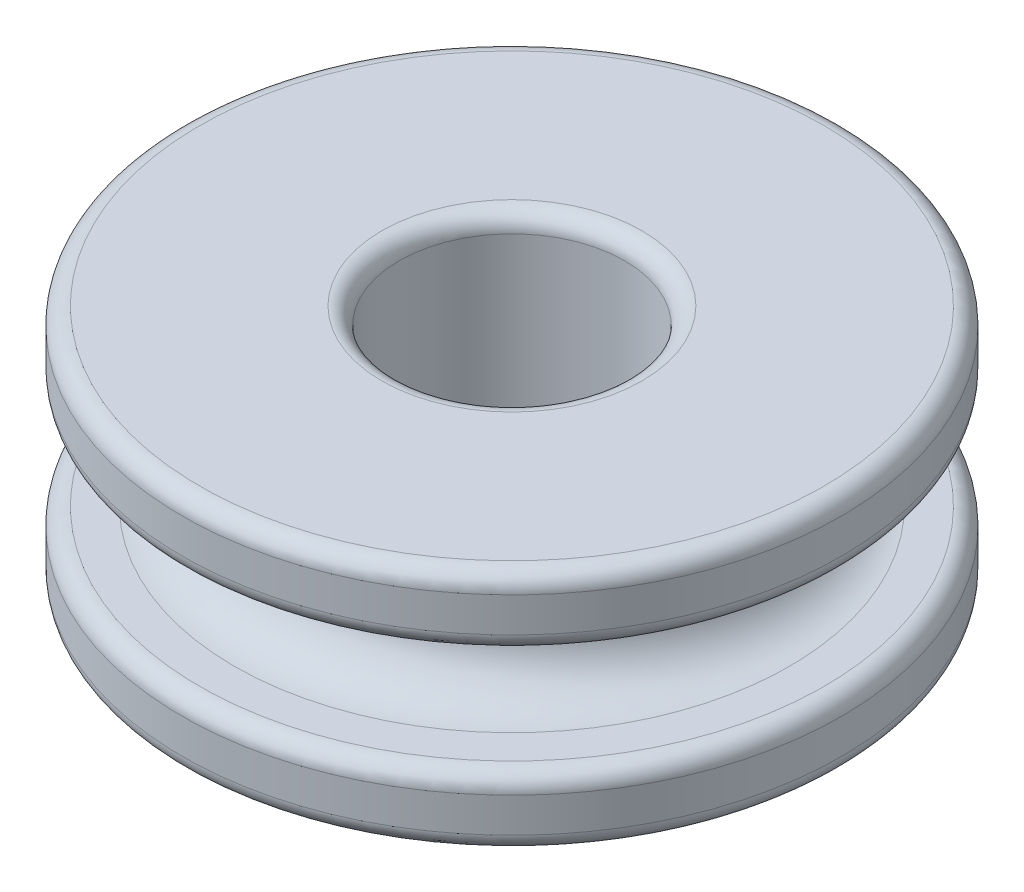
from build123d import *

# Parameters (mm, degrees)
FILLET1_R = 0.5


with BuildPart() as part:
    # Sketch1 → Revolve1 (revolve)
    with BuildSketch(Plane.XY):
        with BuildLine():
            Line((1.625, 3.5), (1.625, -3.5))
            Line((1.625, -3.5), (6.375, -3.5))
            Line((6.375, -3.5), (7.875, -3.5))
            Line((7.875, -3.5), (7.875, -1.5))
            Line((7.875, -1.5), (6.375, -1.5))
            ThreePointArc((6.375, -1.5), (4.875, 0), (6.375, 1.5))
            Line((6.375, 1.5), (7.875, 1.5))
            Line((7.875, 1.5), (7.875, 3.5))
            Line((7.875, 3.5), (6.375, 3.5))
            Line((6.375, 3.5), (1.625, 3.5))
        make_face()
    revolve(axis=Axis((-1.625, -3.5, 0), (0, 1, 0)))

    # Fillet1
    fillet1_edges = [part.edges().sort_by_distance(p)[0] for p in [
        (-4.875, -3.5, 0),
        (-4.875, 3.5, 0),
        (-11.125, 1.5, 0),
        (-11.125, -1.5, 0),
        (-11.125, 3.5, 0),
        (-11.125, -3.5, 0),
    ]]
    fillet(fillet1_edges, radius=FILLET1_R)


solid = part.part
